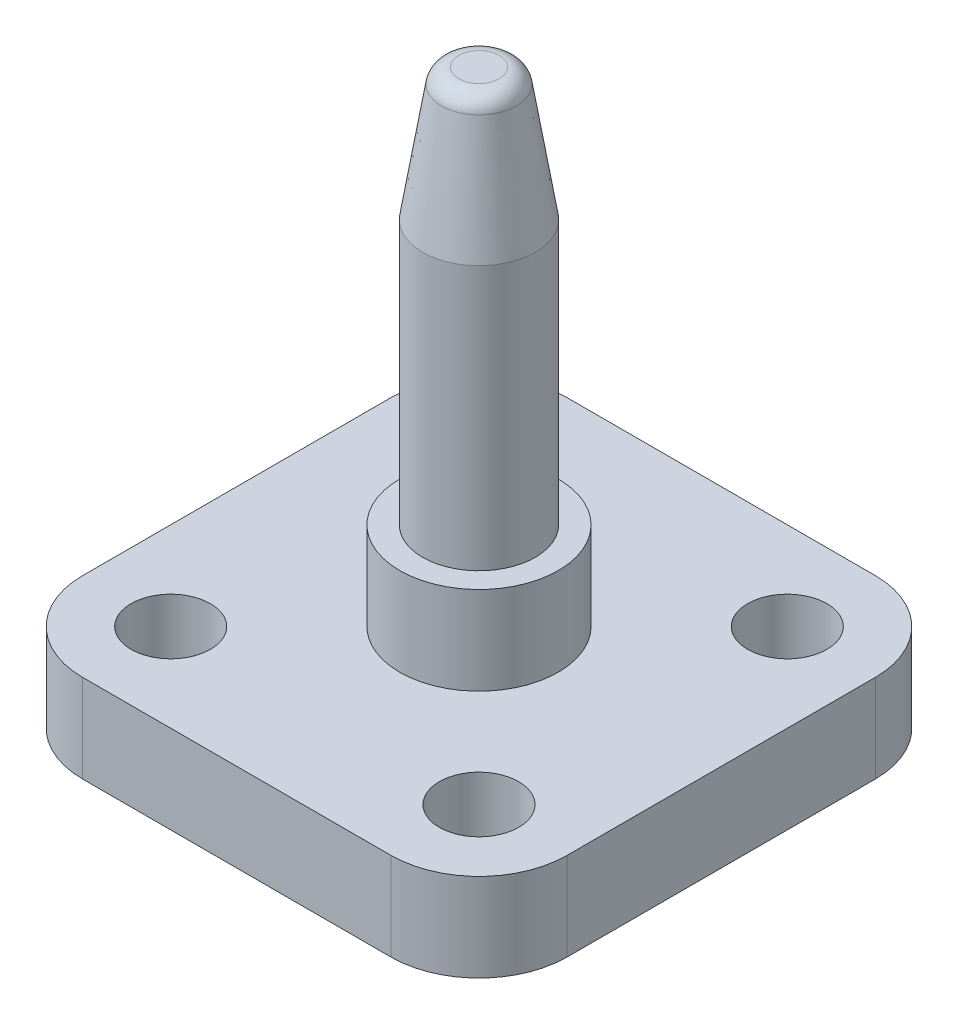
from build123d import *

# Parameters (mm, degrees)
BOSS_EXTRUDE1_DEPTH                        = 10
SKETCH3_R                                  = 4.5
CUT_EXTRUDE1_DEPTH                         = 68.360967927
MIRROR1_AT_THE_SECOND_PLANE_COPY_1_SKETC_R = 4.5
MIRROR1_AT_THE_SECOND_PLANE_COPY_1_DEPTH   = 68.360967927


with BuildPart() as part:
    # Sketch1 → Revolve1 (revolve)
    with BuildSketch(Plane.XY):
        with BuildLine():
            Line((0, 27.5), (2.294561776, 27.5))
            ThreePointArc((2.294561776, 27.5), (3.592259351, 27.021834749), (4.26944304, 25.815981002))
            Line((4.26944304, 25.815981002), (6.4, 12.5))
            Line((6.4, 12.5), (6.4, -17.5))
            Line((6.4, -17.5), (9, -17.5))
            Line((9, -17.5), (9, -27.5))
            Line((9, -27.5), (6.4, -27.5))
            Line((6.4, -27.5), (0, -27.5))
            Line((0, -27.5), (0, 27.5))
        make_face()
    revolve(axis=Axis((0, 27.5, 0), (0, -1, 0)))

    # Sketch2 → Boss-Extrude1 (add)
    with BuildSketch(Plane.XZ.offset(27.5)):
        with BuildLine():
            Line((17.5, 27.5), (-17.5, 27.5))
            ThreePointArc((-17.5, 27.5), (-24.571067812, 24.571067812), (-27.5, 17.5))
            Line((-27.5, 17.5), (-27.5, -17.5))
            ThreePointArc((-27.5, -17.5), (-24.571067812, -24.571067812), (-17.5, -27.5))
            Line((-17.5, -27.5), (17.5, -27.5))
            ThreePointArc((17.5, -27.5), (24.571067812, -24.571067812), (27.5, -17.5))
            Line((27.5, -17.5), (27.5, 17.5))
            ThreePointArc((27.5, 17.5), (24.571067812, 24.571067812), (17.5, 27.5))
        make_face()
    extrude(amount=BOSS_EXTRUDE1_DEPTH)

    # Sketch3 → Cut-Extrude1 (cut, through all)
    with BuildSketch(Plane(origin=(0, -27.5, 0), x_dir=(1, 0, 0), z_dir=(0, 1, 0))):
        with Locations((-17.5, 17.5)):
            Circle(SKETCH3_R)
    cut_extrude1 = extrude(amount=-CUT_EXTRUDE1_DEPTH, mode=Mode.SUBTRACT)

    # Mirror1: Cut-Extrude1 across plane
    add(cut_extrude1.mirror(Plane.XY), mode=Mode.SUBTRACT)

    # Mirror1 at the second plane: Cut-Extrude1 across plane
    add(cut_extrude1.mirror(Plane(origin=(0, 0, 0), x_dir=(0, 0, 1), z_dir=(1, 0, 0))), mode=Mode.SUBTRACT)

    # Mirror1 at the second plane copy 1 sketc → Mirror1 at the second plane copy 1 (cut, through all)
    with BuildSketch(Plane(origin=(0, -27.5, 0), x_dir=(-1, 0, 0), z_dir=(0, 1, 0))):
        with Locations((-17.5, 17.5)):
            Circle(MIRROR1_AT_THE_SECOND_PLANE_COPY_1_SKETC_R)
    extrude(amount=-MIRROR1_AT_THE_SECOND_PLANE_COPY_1_DEPTH, mode=Mode.SUBTRACT)


solid = part.part
